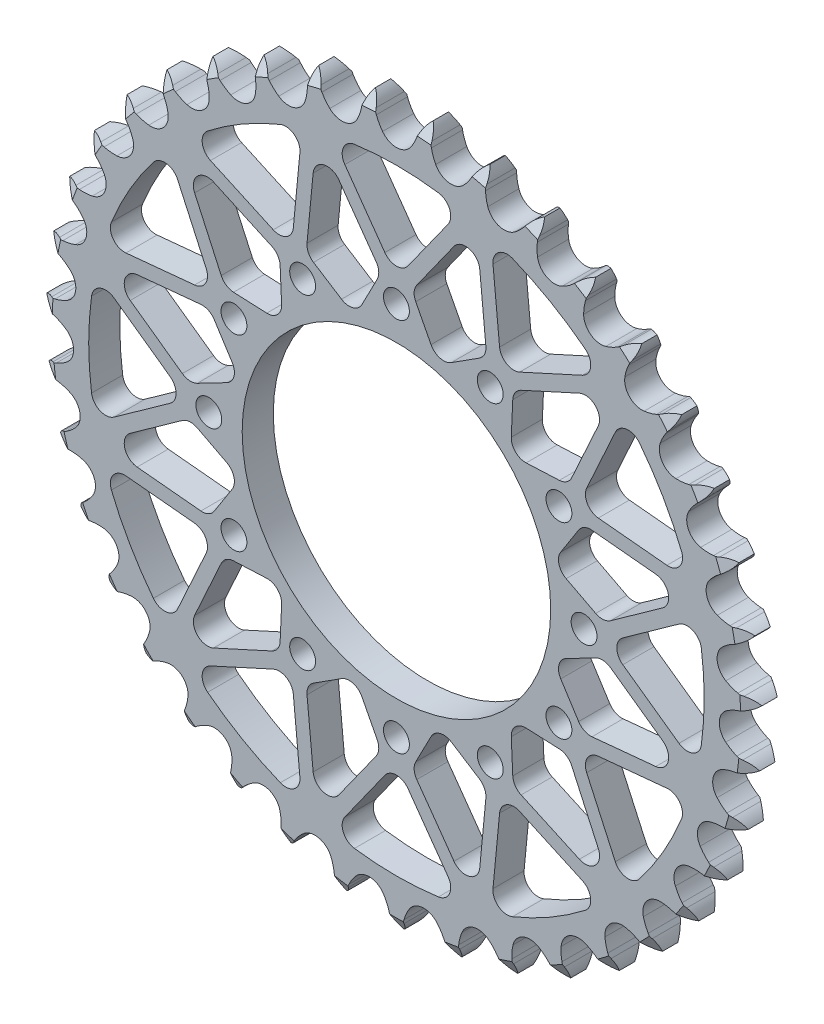
from build123d import *

# Parameters (mm, degrees)
EXTRUSION_DEPTH          = 7.2136
CUT_EXTRUDE_DEPTH        = 118.514389318
CUT_EXTRUDE_DEPTH_BACK   = 118.514389318
SKETCH1_R                = 35.764294032
F_6_0MM_DOWEL_HOLE1_D    = 6
CIRPATTERN1_COUNT        = 12
CUT_EXTRUDE2_DEPTH       = 118.514389318
FILLET2_R                = 3.302
CIRPATTERN3_COUNT        = 12
FILLET2_OF_CIRPATTERN3_R = 3.302


with BuildPart() as part:
    # Teeth Sketch → Extrusion (new body)
    with BuildSketch(Plane.XY):
        with BuildLine():
            ThreePointArc((6.676484762, 82.703103732), (5.710873677, 81.555589606), (5.037571935, 80.215493266))
            Line((5.037571935, 80.215493266), (4.65053543, 79.150636707))
            ThreePointArc((4.65053543, 79.150636707), (4.030589042, 77.787636082), (3.22092759, 76.5280518))
            ThreePointArc((3.22092759, 76.5280518), (0, 74.905926143), (-3.22092759, 76.5280518))
            ThreePointArc((-3.22092759, 76.5280518), (-4.030589042, 77.787636082), (-4.65053543, 79.150636707))
            Line((-4.65053543, 79.150636707), (-5.037571935, 80.215493266))
            ThreePointArc((-5.037571935, 80.215493266), (-5.710873677, 81.555589606), (-6.676484762, 82.703103732))
            ThreePointArc((-6.676484762, 82.703103732), (-7.445517227, 81.415554702), (-7.895133318, 79.984807062))
            Line((-7.895133318, 79.984807062), (-8.106342797, 78.871655094))
            ThreePointArc((-8.106342797, 78.871655094), (-8.499620367, 77.426858575), (-9.096745387, 76.053706749))
            ThreePointArc((-9.096745387, 76.053706749), (-12.015755556, 73.935914073), (-15.455180235, 75.020360508))
            ThreePointArc((-15.455180235, 75.020360508), (-16.456408311, 76.133754674), (-17.286967233, 77.379658404))
            Line((-17.286967233, 77.379658404), (-17.83980672, 78.368640329))
            ThreePointArc((-17.83980672, 78.368640329), (-18.719355953, 79.583377579), (-19.856536839, 80.561136787))
            ThreePointArc((-19.856536839, 80.561136787), (-20.409073146, 79.166899696), (-20.623358765, 77.682556369))
            Line((-20.623358765, 77.682556369), (-20.653271004, 76.549939044))
            ThreePointArc((-20.653271004, 76.549939044), (-20.809694072, 75.060766102), (-21.178817437, 73.609610642))
            ThreePointArc((-21.178817437, 73.609610642), (-23.720309356, 71.051000665), (-27.289151829, 71.569681286))
            ThreePointArc((-27.289151829, 71.569681286), (-28.456015249, 72.508049011), (-29.475675664, 73.604587595))
            Line((-29.475675664, 73.604587595), (-30.179999883, 74.492080773))
            ThreePointArc((-30.179999883, 74.492080773), (-31.243016742, 75.549997876), (-32.522315041, 76.332678717))
            ThreePointArc((-32.522315041, 76.332678717), (-32.844044791, 74.867863573), (-32.817450053, 73.368368272))
            Line((-32.817450053, 73.368368272), (-32.66529034, 72.245619783))
            ThreePointArc((-32.66529034, 72.245619783), (-32.580807632, 70.750639215), (-32.71236924, 69.259064285))
            ThreePointArc((-32.71236924, 69.259064285), (-34.810519602, 66.325903661), (-38.416348726, 66.265384911))
            ThreePointArc((-38.416348726, 66.265384911), (-39.71862634, 67.004422965), (-40.900979579, 67.923196629))
            Line((-40.900979579, 67.923196629), (-41.738546902, 68.686215454))
            ThreePointArc((-41.738546902, 68.686215454), (-42.957499809, 69.559912912), (-44.345782367, 70.127244363))
            ThreePointArc((-44.345782367, 70.127244363), (-44.428372928, 68.629789109), (-44.161586623, 67.153977974))
            Line((-44.161586623, 67.153977974), (-43.831295815, 66.070176918))
            ThreePointArc((-43.831295815, 66.070176918), (-43.508095388, 64.608107935), (-43.398687863, 63.114744543))
            ThreePointArc((-43.398687863, 63.114744543), (-44.999155676, 59.883000591), (-48.54858237, 59.244849876))
            ThreePointArc((-48.54858237, 59.244849876), (-49.952545871, 59.765417561), (-51.266969607, 60.48263055))
            Line((-51.266969607, 60.48263055), (-52.21608748, 61.101413234))
            ThreePointArc((-52.21608748, 61.101413234), (-53.559406195, 61.768262742), (-55.020717224, 62.105551216))
            ThreePointArc((-55.020717224, 62.105551216), (-54.862029543, 60.614239157), (-54.361961296, 59.200334922))
            Line((-54.361961296, 59.200334922), (-53.862093752, 58.183551176))
            ThreePointArc((-53.862093752, 58.183551176), (-53.308546327, 56.792260597), (-52.961003266, 55.335786069))
            ThreePointArc((-52.961003266, 55.335786069), (-54.022337255, 51.889159262), (-57.423433231, 50.689904348))
            ThreePointArc((-57.423433231, 50.689904348), (-58.892720703, 50.978519235), (-60.305172051, 51.475596109))
            Line((-60.305172051, 51.475596109), (-61.34125882, 51.934116506))
            ThreePointArc((-61.34125882, 51.934116506), (-62.774152094, 52.376847013), (-64.270644405, 52.475356916))
            ThreePointArc((-64.270644405, 52.475356916), (-63.87478841, 51.02881225), (-63.154389727, 49.713434291))
            Line((-63.154389727, 49.713434291), (-62.497891753, 48.790002021))
            ThreePointArc((-62.497891753, 48.790002021), (-61.728333918, 47.505523541), (-61.151656504, 46.123659804))
            ThreePointArc((-61.151656504, 46.123659804), (-61.646368676, 42.551415963), (-64.811047336, 40.822116924))
            ThreePointArc((-64.811047336, 40.822116924), (-66.307605004, 40.871304038), (-67.781502216, 41.135370767))
            Line((-67.781502216, 41.135370767), (-68.877723777, 41.42175344))
            ThreePointArc((-68.877723777, 41.42175344), (-70.363080428, 41.628898458), (-71.855995657, 41.486078435))
            ThreePointArc((-71.855995657, 41.486078435), (-71.23322381, 40.12176591), (-70.311152637, 38.938981826))
            Line((-70.311152637, 38.938981826), (-69.515027187, 38.132817442))
            ThreePointArc((-69.515027187, 38.132817442), (-68.549390085, 36.988418379), (-67.75851396, 35.716954977))
            ThreePointArc((-67.75851396, 35.716954977), (-67.673791529, 32.111613343), (-70.520089358, 29.897058114))
            ThreePointArc((-70.520089358, 29.897058114), (-72.005157166, 29.705543536), (-73.502327078, 29.729760931))
            Line((-73.502327078, 29.729760931), (-74.630291869, 29.836588719))
            ThreePointArc((-74.630291869, 29.836588719), (-76.129641939, 29.8027833), (-77.580314364, 29.422332315))
            ThreePointArc((-77.580314364, 29.422332315), (-76.74675613, 28.175586908), (-75.646893627, 27.156030185))
            Line((-75.646893627, 27.156030185), (-74.731759931, 26.488012922))
            ThreePointArc((-74.731759931, 26.488012922), (-73.595053056, 25.51333261), (-72.610461496, 24.385199777))
            ThreePointArc((-72.610461496, 24.385199777), (-71.948498729, 20.840136804), (-74.402698108, 18.197681204))
            ThreePointArc((-74.402698108, 18.197681204), (-75.837813579, 17.77042506), (-77.319480277, 17.554165902))
            Line((-77.319480277, 17.554165902), (-78.449974603, 17.478672021))
            ThreePointArc((-78.449974603, 17.478672021), (-79.924485713, 17.204791709), (-81.295343681, 16.596563242))
            ThreePointArc((-81.295343681, 16.596563242), (-80.27258778, 15.499675005), (-79.023419807, 14.669751627))
            Line((-79.023419807, 14.669751627), (-78.012979347, 14.15718278))
            ThreePointArc((-78.012979347, 14.15718278), (-76.734642811, 13.377464928), (-75.58183622, 12.421880712))
            ThreePointArc((-75.58183622, 12.421880712), (-74.359777605, 9.028911669), (-76.358316059, 6.026993909))
            ThreePointArc((-76.358316059, 6.026993909), (-77.706310456, 5.375061909), (-79.134099551, 4.923927198))
            Line((-79.134099551, 4.923927198), (-80.237844202, 4.6680669))
            ThreePointArc((-80.237844202, 4.6680669), (-81.649327289, 4.161205049), (-82.904866299, 3.340951899))
            ThreePointArc((-82.904866299, 3.340951899), (-81.719401571, 2.422329661), (-80.353280924, 1.803534207))
            Line((-80.353280924, 1.803534207), (-79.273703577, 1.45968904))
            ThreePointArc((-79.273703577, 1.45968904), (-77.886845624, 0.895127931), (-76.595681088, 0.136841462))
            ThreePointArc((-76.595681088, 0.136841462), (-74.8451773, -3.016157536), (-76.336293733, -6.299789363))
            ThreePointArc((-76.336293733, -6.299789363), (-77.56225471, -7.159512522), (-78.899187214, -7.833838635))
            Line((-78.899187214, -7.833838635), (-79.947595784, -8.263438702))
            ThreePointArc((-79.947595784, -8.263438702), (-81.259494176, -8.990154635), (-82.367196428, -10.001188343))
            ThreePointArc((-82.367196428, -10.001188343), (-81.049725787, -10.717752749), (-79.602034272, -11.109393802))
            Line((-79.602034272, -11.109393802), (-78.481280524, -11.275609878))
            ThreePointArc((-78.481280524, -11.275609878), (-77.021820047, -11.610392409), (-75.625738049, -12.151741911))
            ThreePointArc((-75.625738049, -12.151741911), (-73.392126218, -14.983109845), (-74.337201497, -18.463411399))
            ThreePointArc((-74.337201497, -18.463411399), (-75.409377308, -19.50865934), (-76.620827372, -20.388712162))
            Line((-76.620827372, -20.388712162), (-77.586746629, -20.980925582))
            ThreePointArc((-77.586746629, -20.980925582), (-78.765082849, -21.908674036), (-79.696259435, -23.08430306))
            ThreePointArc((-79.696259435, -23.08430306), (-78.280904679, -23.580250992), (-76.789136745, -23.734594346))
            Line((-76.789136745, -23.734594346), (-75.656233531, -23.718876424))
            ThreePointArc((-75.656233531, -23.718876424), (-74.161969788, -23.815209685), (-72.697128119, -24.125601551))
            ThreePointArc((-72.697128119, -24.125601551), (-70.038257617, -26.562007479), (-70.41281479, -30.148840778))
            ThreePointArc((-70.41281479, -30.148840778), (-71.303436645, -31.352542128), (-72.358028349, -32.415528753))
            Line((-72.358028349, -32.415528753), (-73.216441492, -33.155017511))
            ThreePointArc((-73.216441492, -33.155017511), (-74.230697248, -34.259770288), (-74.961231185, -35.569546454))
            ThreePointArc((-74.961231185, -35.569546454), (-73.484649258, -35.832033121), (-71.987440912, -35.745081364))
            Line((-71.987440912, -35.745081364), (-70.871729829, -35.547836529))
            ThreePointArc((-70.871729829, -35.547836529), (-69.381363468, -35.403225539), (-67.885700756, -35.474620783))
            ThreePointArc((-67.885700756, -35.474620783), (-64.870434934, -37.452963072), (-64.664773166, -41.053431017))
            ThreePointArc((-64.664773166, -41.053431017), (-65.350774426, -42.384410543), (-66.221194398, -43.602800177))
            Line((-66.221194398, -43.602800177), (-66.949868978, -44.470411902))
            ThreePointArc((-66.949868978, -44.470411902), (-67.773775581, -45.723556485), (-68.284746423, -47.133557278))
            ThreePointArc((-68.284746423, -47.133557278), (-66.785180021, -47.155784414), (-65.321308173, -46.829789551))
            Line((-65.321308173, -46.829789551), (-64.251685552, -46.456126341))
            ThreePointArc((-64.251685552, -46.456126341), (-62.803816278, -46.074316448), (-61.316069403, -45.904865971))
            ThreePointArc((-61.316069403, -45.904865971), (-58.022502061, -47.373906594), (-57.241947884, -50.894758957))
            ThreePointArc((-57.241947884, -50.894758957), (-57.705561477, -52.318544989), (-58.369266298, -53.66078198))
            Line((-58.369266298, -53.66078198), (-58.949330025, -54.634045983))
            ThreePointArc((-58.949330025, -54.634045983), (-59.561548726, -56.003126587), (-59.839722596, -57.476833727))
            ThreePointArc((-59.839722596, -57.476833727), (-58.356009703, -57.25822566), (-56.963387864, -56.701630787))
            Line((-56.963387864, -56.701630787), (-55.967556369, -56.161226883))
            ThreePointArc((-55.967556369, -56.161226883), (-54.599683236, -55.552106762), (-53.15838406, -55.146199243))
            ThreePointArc((-53.15838406, -55.146199243), (-49.671816862, -56.06789082), (-48.336586219, -59.417939375))
            ThreePointArc((-48.336586219, -59.417939375), (-48.565804798, -60.897656602), (-49.00560486, -62.328977716))
            Line((-49.00560486, -62.328977716), (-49.422034389, -63.382686971))
            ThreePointArc((-49.422034389, -63.382686971), (-49.806709045, -64.832245127), (-49.844881387, -66.331490374))
            ThreePointArc((-49.844881387, -66.331490374), (-48.415449386, -65.877708938), (-47.130145731, -65.104929569))
            Line((-47.130145731, -65.104929569), (-46.233896874, -64.411781148))
            ThreePointArc((-46.233896874, -64.411781148), (-44.981447078, -63.591126692), (-43.623924493, -62.959274922))
            ThreePointArc((-43.623924493, -62.959274922), (-40.034657698, -63.309746125), (-38.179332362, -66.402226373))
            ThreePointArc((-38.179332362, -66.402226373), (-38.168219284, -67.899550896), (-38.372723998, -69.38288567))
            Line((-38.372723998, -69.38288567), (-38.614734022, -70.489749661))
            ThreePointArc((-38.614734022, -70.489749661), (-38.761901763, -71.982242573), (-38.559083932, -73.468196262))
            ThreePointArc((-38.559083932, -73.468196262), (-37.220954361, -72.790994159), (-36.076257579, -71.822044874))
            Line((-36.076257579, -71.822044874), (-35.302803736, -70.994104116))
            ThreePointArc((-35.302803736, -70.994104116), (-34.198215068, -69.983169844), (-32.959628196, -69.141738451))
            ThreePointArc((-32.959628196, -69.141738451), (-29.360621929, -68.91191226), (-27.033253851, -71.666730588))
            ThreePointArc((-27.033253851, -71.666730588), (-26.78209694, -73.142882488), (-26.74600974, -74.639813329))
            Line((-26.74600974, -74.639813329), (-26.807332328, -75.77116486))
            ThreePointArc((-26.807332328, -75.77116486), (-26.713181585, -77.267937748), (-26.274626458, -78.702114459))
            ThreePointArc((-26.274626458, -78.702114459), (-25.06245617, -77.819030866), (-24.088013307, -76.679006943))
            Line((-24.088013307, -76.679006943), (-23.457386525, -75.737717079))
            ThreePointArc((-23.457386525, -75.737717079), (-22.529267252, -74.562685657), (-21.441694841, -73.533467273))
            ThreePointArc((-21.441694841, -73.533467273), (-17.926161474, -72.729296065), (-15.187028265, -75.075104125))
            ThreePointArc((-15.187028265, -75.075104125), (-14.702332353, -76.491851845), (-14.426587879, -77.96360903))
            Line((-14.426587879, -77.96360903), (-14.305634807, -79.090146691))
            ThreePointArc((-14.305634807, -79.090146691), (-13.972604036, -80.552433921), (-13.309669959, -81.897689231))
            ThreePointArc((-13.309669959, -81.897689231), (-12.254853529, -80.83159555), (-11.475902142, -79.55002301))
            Line((-11.475902142, -79.55002301), (-11.004435324, -78.519762952))
            ThreePointArc((-11.004435324, -78.519762952), (-10.276823247, -77.211067077), (-9.368432854, -76.020717918))
            ThreePointArc((-9.368432854, -76.020717918), (-6.027422853, -74.663029306), (-2.947466624, -76.5390719))
            ThreePointArc((-2.947466624, -76.5390719), (-2.241785081, -77.859722417), (-1.733524971, -79.26818821))
            Line((-1.733524971, -79.26818821), (-1.43342886, -80.360735266))
            ThreePointArc((-1.43342886, -80.360735266), (-0.870143382, -81.750664368), (0, -82.97215687))
            ThreePointArc((0, -82.97215687), (0.870143382, -81.750664368), (1.43342886, -80.360735266))
            Line((1.43342886, -80.360735266), (1.733524971, -79.26818821))
            ThreePointArc((1.733524971, -79.26818821), (2.241785081, -77.859722417), (2.947466624, -76.5390719))
            ThreePointArc((2.947466624, -76.5390719), (6.027422853, -74.663029306), (9.368432854, -76.020717918))
            ThreePointArc((9.368432854, -76.020717918), (10.276823247, -77.211067077), (11.004435324, -78.519762952))
            Line((11.004435324, -78.519762952), (11.475902142, -79.55002301))
            ThreePointArc((11.475902142, -79.55002301), (12.254853529, -80.83159555), (13.309669959, -81.897689231))
            ThreePointArc((13.309669959, -81.897689231), (13.972604036, -80.552433921), (14.305634807, -79.090146691))
            Line((14.305634807, -79.090146691), (14.426587879, -77.96360903))
            ThreePointArc((14.426587879, -77.96360903), (14.702332353, -76.491851845), (15.187028265, -75.075104125))
            ThreePointArc((15.187028265, -75.075104125), (17.926161474, -72.729296065), (21.441694841, -73.533467273))
            ThreePointArc((21.441694841, -73.533467273), (22.529267252, -74.562685657), (23.457386525, -75.737717079))
            Line((23.457386525, -75.737717079), (24.088013307, -76.679006943))
            ThreePointArc((24.088013307, -76.679006943), (25.06245617, -77.819030866), (26.274626458, -78.702114459))
            ThreePointArc((26.274626458, -78.702114459), (26.713181585, -77.267937748), (26.807332328, -75.77116486))
            Line((26.807332328, -75.77116486), (26.74600974, -74.639813329))
            ThreePointArc((26.74600974, -74.639813329), (26.78209694, -73.142882488), (27.033253851, -71.666730588))
            ThreePointArc((27.033253851, -71.666730588), (29.360621929, -68.91191226), (32.959628196, -69.141738451))
            ThreePointArc((32.959628196, -69.141738451), (34.198215068, -69.983169844), (35.302803736, -70.994104116))
            Line((35.302803736, -70.994104116), (36.076257579, -71.822044874))
            ThreePointArc((36.076257579, -71.822044874), (37.220954361, -72.790994159), (38.559083932, -73.468196262))
            ThreePointArc((38.559083932, -73.468196262), (38.761901763, -71.982242573), (38.614734022, -70.489749661))
            Line((38.614734022, -70.489749661), (38.372723998, -69.38288567))
            ThreePointArc((38.372723998, -69.38288567), (38.168219284, -67.899550896), (38.179332362, -66.402226373))
            ThreePointArc((38.179332362, -66.402226373), (40.034657698, -63.309746125), (43.623924493, -62.959274922))
            ThreePointArc((43.623924493, -62.959274922), (44.981447078, -63.591126692), (46.233896874, -64.411781148))
            Line((46.233896874, -64.411781148), (47.130145731, -65.104929569))
            ThreePointArc((47.130145731, -65.104929569), (48.415449386, -65.877708938), (49.844881387, -66.331490374))
            ThreePointArc((49.844881387, -66.331490374), (49.806709045, -64.832245127), (49.422034389, -63.382686971))
            Line((49.422034389, -63.382686971), (49.00560486, -62.328977716))
            ThreePointArc((49.00560486, -62.328977716), (48.565804798, -60.897656602), (48.336586219, -59.417939375))
            ThreePointArc((48.336586219, -59.417939375), (49.671816862, -56.06789082), (53.15838406, -55.146199243))
            ThreePointArc((53.15838406, -55.146199243), (54.599683236, -55.552106762), (55.967556369, -56.161226883))
            Line((55.967556369, -56.161226883), (56.963387864, -56.701630787))
            ThreePointArc((56.963387864, -56.701630787), (58.356009703, -57.25822566), (59.839722596, -57.476833727))
            ThreePointArc((59.839722596, -57.476833727), (59.561548726, -56.003126587), (58.949330025, -54.634045983))
            Line((58.949330025, -54.634045983), (58.369266298, -53.66078198))
            ThreePointArc((58.369266298, -53.66078198), (57.705561477, -52.318544989), (57.241947884, -50.894758957))
            ThreePointArc((57.241947884, -50.894758957), (58.022502061, -47.373906594), (61.316069403, -45.904865971))
            ThreePointArc((61.316069403, -45.904865971), (62.803816278, -46.074316448), (64.251685552, -46.456126341))
            Line((64.251685552, -46.456126341), (65.321308173, -46.829789551))
            ThreePointArc((65.321308173, -46.829789551), (66.785180021, -47.155784414), (68.284746423, -47.133557278))
            ThreePointArc((68.284746423, -47.133557278), (67.773775581, -45.723556485), (66.949868978, -44.470411902))
            Line((66.949868978, -44.470411902), (66.221194398, -43.602800177))
            ThreePointArc((66.221194398, -43.602800177), (65.350774426, -42.384410543), (64.664773166, -41.053431017))
            ThreePointArc((64.664773166, -41.053431017), (64.870434934, -37.452963072), (67.885700756, -35.474620783))
            ThreePointArc((67.885700756, -35.474620783), (69.381363468, -35.403225539), (70.871729829, -35.547836529))
            Line((70.871729829, -35.547836529), (71.987440912, -35.745081364))
            ThreePointArc((71.987440912, -35.745081364), (73.484649258, -35.832033121), (74.961231185, -35.569546454))
            ThreePointArc((74.961231185, -35.569546454), (74.230697248, -34.259770288), (73.216441492, -33.155017511))
            Line((73.216441492, -33.155017511), (72.358028349, -32.415528753))
            ThreePointArc((72.358028349, -32.415528753), (71.303436645, -31.352542128), (70.41281479, -30.148840778))
            ThreePointArc((70.41281479, -30.148840778), (70.038257617, -26.562007479), (72.697128119, -24.125601551))
            ThreePointArc((72.697128119, -24.125601551), (74.161969788, -23.815209685), (75.656233531, -23.718876424))
            Line((75.656233531, -23.718876424), (76.789136745, -23.734594346))
            ThreePointArc((76.789136745, -23.734594346), (78.280904679, -23.580250992), (79.696259435, -23.08430306))
            ThreePointArc((79.696259435, -23.08430306), (78.765082849, -21.908674036), (77.586746629, -20.980925582))
            Line((77.586746629, -20.980925582), (76.620827372, -20.388712162))
            ThreePointArc((76.620827372, -20.388712162), (75.409377308, -19.50865934), (74.337201497, -18.463411399))
            ThreePointArc((74.337201497, -18.463411399), (73.392126218, -14.983109845), (75.625738049, -12.151741911))
            ThreePointArc((75.625738049, -12.151741911), (77.021820047, -11.610392409), (78.481280524, -11.275609878))
            Line((78.481280524, -11.275609878), (79.602034272, -11.109393802))
            ThreePointArc((79.602034272, -11.109393802), (81.049725787, -10.717752749), (82.367196428, -10.001188343))
            ThreePointArc((82.367196428, -10.001188343), (81.259494176, -8.990154635), (79.947595784, -8.263438702))
            Line((79.947595784, -8.263438702), (78.899187214, -7.833838635))
            ThreePointArc((78.899187214, -7.833838635), (77.56225471, -7.159512522), (76.336293733, -6.299789363))
            ThreePointArc((76.336293733, -6.299789363), (74.8451773, -3.016157536), (76.595681088, 0.136841462))
            ThreePointArc((76.595681088, 0.136841462), (77.886845624, 0.895127931), (79.273703577, 1.45968904))
            Line((79.273703577, 1.45968904), (80.353280924, 1.803534207))
            ThreePointArc((80.353280924, 1.803534207), (81.719401571, 2.422329661), (82.904866299, 3.340951899))
            ThreePointArc((82.904866299, 3.340951899), (81.649327289, 4.161205049), (80.237844202, 4.6680669))
            Line((80.237844202, 4.6680669), (79.134099551, 4.923927198))
            ThreePointArc((79.134099551, 4.923927198), (77.706310456, 5.375061909), (76.358316059, 6.026993909))
            ThreePointArc((76.358316059, 6.026993909), (74.359777605, 9.028911669), (75.58183622, 12.421880712))
            ThreePointArc((75.58183622, 12.421880712), (76.734642811, 13.377464928), (78.012979347, 14.15718278))
            Line((78.012979347, 14.15718278), (79.023419807, 14.669751627))
            ThreePointArc((79.023419807, 14.669751627), (80.27258778, 15.499675005), (81.295343681, 16.596563242))
            ThreePointArc((81.295343681, 16.596563242), (79.924485713, 17.204791709), (78.449974603, 17.478672021))
            Line((78.449974603, 17.478672021), (77.319480277, 17.554165902))
            ThreePointArc((77.319480277, 17.554165902), (75.837813579, 17.77042506), (74.402698108, 18.197681204))
            ThreePointArc((74.402698108, 18.197681204), (71.948498729, 20.840136804), (72.610461496, 24.385199777))
            ThreePointArc((72.610461496, 24.385199777), (73.595053056, 25.51333261), (74.731759931, 26.488012922))
            Line((74.731759931, 26.488012922), (75.646893627, 27.156030185))
            ThreePointArc((75.646893627, 27.156030185), (76.74675613, 28.175586908), (77.580314364, 29.422332315))
            ThreePointArc((77.580314364, 29.422332315), (76.129641939, 29.8027833), (74.630291869, 29.836588719))
            Line((74.630291869, 29.836588719), (73.502327078, 29.729760931))
            ThreePointArc((73.502327078, 29.729760931), (72.005157166, 29.705543536), (70.520089358, 29.897058114))
            ThreePointArc((70.520089358, 29.897058114), (67.673791529, 32.111613343), (67.75851396, 35.716954977))
            ThreePointArc((67.75851396, 35.716954977), (68.549390085, 36.988418379), (69.515027187, 38.132817442))
            Line((69.515027187, 38.132817442), (70.311152637, 38.938981826))
            ThreePointArc((70.311152637, 38.938981826), (71.23322381, 40.12176591), (71.855995657, 41.486078435))
            ThreePointArc((71.855995657, 41.486078435), (70.363080428, 41.628898458), (68.877723777, 41.42175344))
            Line((68.877723777, 41.42175344), (67.781502216, 41.135370767))
            ThreePointArc((67.781502216, 41.135370767), (66.307605004, 40.871304038), (64.811047336, 40.822116924))
            ThreePointArc((64.811047336, 40.822116924), (61.646368676, 42.551415963), (61.151656504, 46.123659804))
            ThreePointArc((61.151656504, 46.123659804), (61.728333918, 47.505523541), (62.497891753, 48.790002021))
            Line((62.497891753, 48.790002021), (63.154389727, 49.713434291))
            ThreePointArc((63.154389727, 49.713434291), (63.87478841, 51.02881225), (64.270644405, 52.475356916))
            ThreePointArc((64.270644405, 52.475356916), (62.774152094, 52.376847013), (61.34125882, 51.934116506))
            Line((61.34125882, 51.934116506), (60.305172051, 51.475596109))
            ThreePointArc((60.305172051, 51.475596109), (58.892720703, 50.978519235), (57.423433231, 50.689904348))
            ThreePointArc((57.423433231, 50.689904348), (54.022337255, 51.889159262), (52.961003266, 55.335786069))
            ThreePointArc((52.961003266, 55.335786069), (53.308546327, 56.792260597), (53.862093752, 58.183551176))
            Line((53.862093752, 58.183551176), (54.361961296, 59.200334922))
            ThreePointArc((54.361961296, 59.200334922), (54.862029543, 60.614239157), (55.020717224, 62.105551216))
            ThreePointArc((55.020717224, 62.105551216), (53.559406195, 61.768262742), (52.21608748, 61.101413234))
            Line((52.21608748, 61.101413234), (51.266969607, 60.48263055))
            ThreePointArc((51.266969607, 60.48263055), (49.952545871, 59.765417561), (48.54858237, 59.244849876))
            ThreePointArc((48.54858237, 59.244849876), (44.999155676, 59.883000591), (43.398687863, 63.114744543))
            ThreePointArc((43.398687863, 63.114744543), (43.508095388, 64.608107935), (43.831295815, 66.070176918))
            Line((43.831295815, 66.070176918), (44.161586623, 67.153977974))
            ThreePointArc((44.161586623, 67.153977974), (44.428372928, 68.629789109), (44.345782367, 70.127244363))
            ThreePointArc((44.345782367, 70.127244363), (42.957499809, 69.559912912), (41.738546902, 68.686215454))
            Line((41.738546902, 68.686215454), (40.900979579, 67.923196629))
            ThreePointArc((40.900979579, 67.923196629), (39.71862634, 67.004422965), (38.416348726, 66.265384911))
            ThreePointArc((38.416348726, 66.265384911), (34.810519602, 66.325903661), (32.71236924, 69.259064285))
            ThreePointArc((32.71236924, 69.259064285), (32.580807632, 70.750639215), (32.66529034, 72.245619783))
            Line((32.66529034, 72.245619783), (32.817450053, 73.368368272))
            ThreePointArc((32.817450053, 73.368368272), (32.844044791, 74.867863573), (32.522315041, 76.332678717))
            ThreePointArc((32.522315041, 76.332678717), (31.243016742, 75.549997876), (30.179999883, 74.492080773))
            Line((30.179999883, 74.492080773), (29.475675664, 73.604587595))
            ThreePointArc((29.475675664, 73.604587595), (28.456015249, 72.508049011), (27.289151829, 71.569681286))
            ThreePointArc((27.289151829, 71.569681286), (23.720309356, 71.051000665), (21.178817437, 73.609610642))
            ThreePointArc((21.178817437, 73.609610642), (20.809694072, 75.060766102), (20.653271004, 76.549939044))
            Line((20.653271004, 76.549939044), (20.623358765, 77.682556369))
            ThreePointArc((20.623358765, 77.682556369), (20.409073146, 79.166899696), (19.856536839, 80.561136787))
            ThreePointArc((19.856536839, 80.561136787), (18.719355953, 79.583377579), (17.83980672, 78.368640329))
            Line((17.83980672, 78.368640329), (17.286967233, 77.379658404))
            ThreePointArc((17.286967233, 77.379658404), (16.456408311, 76.133754674), (15.455180235, 75.020360508))
            ThreePointArc((15.455180235, 75.020360508), (12.015755556, 73.935914073), (9.096745387, 76.053706749))
            ThreePointArc((9.096745387, 76.053706749), (8.499620367, 77.426858575), (8.106342797, 78.871655094))
            Line((8.106342797, 78.871655094), (7.895133318, 79.984807062))
            ThreePointArc((7.895133318, 79.984807062), (7.445517227, 81.415554702), (6.676484762, 82.703103732))
        make_face()
    extrude(amount=EXTRUSION_DEPTH)

    # Sketch1 → Cut-Extrude (cut, two sides: drawn at the far end of the back side and taken through both)
    with BuildSketch(Plane(origin=(0, 0, 0), x_dir=(-1, 0, 0), z_dir=(0, 0, -1)).offset(-CUT_EXTRUDE_DEPTH_BACK)):
        Circle(SKETCH1_R)
    extrude(amount=CUT_EXTRUDE_DEPTH + CUT_EXTRUDE_DEPTH_BACK, mode=Mode.SUBTRACT)

    # Ø6.0mm Dowel Hole1 (through all)
    with Locations(Plane.XY.offset(7.2136)):
        with Locations((-43.500000122, 0)):
            f_6_0mm_dowel_hole1 = Hole(F_6_0MM_DOWEL_HOLE1_D / 2)

    # CirPattern1: Ø6.0mm Dowel Hole1 ×12 about axis
    cirpattern1_axis = Axis((0, 0, 7.2136), (0, 0, -1))
    for i in range(1, CIRPATTERN1_COUNT):
        add(f_6_0mm_dowel_hole1.rotate(cirpattern1_axis, i * 360 / CIRPATTERN1_COUNT), mode=Mode.SUBTRACT)

    # Sketch9 → Cut-Extrude2 (cut, through all)
    with BuildSketch(Plane.XY):
        with BuildLine():
            Line((-48.707000122, 0), (-69.753908506, 15.006805414))
            ThreePointArc((-69.753908506, 15.006805414), (-71.349926143, 0), (-69.753908506, -15.006805414))
            Line((-69.753908506, -15.006805414), (-48.707000122, 0))
        make_face()
        Polygon((-43.325238517, 20.926367996), (-68.918736366, 18.466719753), (-47.983941179, 3.539852965), (-36.140398804, 9.683790674), align=None)
    cut_extrude2 = extrude(amount=CUT_EXTRUDE2_DEPTH, mode=Mode.SUBTRACT)

    # Fillet2
    fillet2_edges = [part.edges().sort_by_distance(p)[0] for p in [
        (-68.918736366, 18.466719753, 3.6068),
        (-36.140398804, 9.683790674, 3.6068),
        (-47.983941179, 3.539852965, 3.6068),
        (-43.325238517, 20.926367996, 3.6068),
        (-69.753908506, -15.006805414, 3.6068),
        (-48.707000122, 0, 3.6068),
        (-69.753908506, 15.006805414, 3.6068),
    ]]
    fillet(fillet2_edges, radius=FILLET2_R)

    # CirPattern3: Cut-Extrude2 ×12 about axis
    cirpattern3_axis = Axis((0, 0, 7.2136), (0, 0, -1))
    for i in range(1, CIRPATTERN3_COUNT):
        add(cut_extrude2.rotate(cirpattern3_axis, i * 360 / CIRPATTERN3_COUNT), mode=Mode.SUBTRACT)

    # Fillet2 of CirPattern3
    fillet2_of_cirpattern3_edges = [part.edges().sort_by_distance(p)[0] for p in [
        (-50.452016613, 50.452016613, 3.6068),
        (-26.45660813, 26.45660813, 3.6068),
        (-39.785385552, 27.057573183, 3.6068),
        (-27.057573183, 39.785385552, 3.6068),
        (-67.912059487, 21.880679535, 3.6068),
        (-42.181499448, 24.353500061, 3.6068),
        (-52.905254073, 47.873228971, 3.6068),
        (-18.466719753, 68.918736366, 3.6068),
        (-9.683790674, 36.140398804, 3.6068),
        (-20.926367996, 43.325238517, 3.6068),
        (-3.539852965, 47.983941179, 3.6068),
        (-47.873228971, 52.905254073, 3.6068),
        (-24.353500061, 42.181499448, 3.6068),
        (-21.880679535, 67.912059487, 3.6068),
        (18.466719753, 68.918736366, 3.6068),
        (9.683790674, 36.140398804, 3.6068),
        (3.539852965, 47.983941179, 3.6068),
        (20.926367996, 43.325238517, 3.6068),
        (-15.006805414, 69.753908506, 3.6068),
        (0, 48.707000122, 3.6068),
        (15.006805414, 69.753908506, 3.6068),
        (50.452016613, 50.452016613, 3.6068),
        (26.45660813, 26.45660813, 3.6068),
        (27.057573183, 39.785385552, 3.6068),
        (39.785385552, 27.057573183, 3.6068),
        (21.880679535, 67.912059487, 3.6068),
        (24.353500061, 42.181499448, 3.6068),
        (47.873228971, 52.905254073, 3.6068),
        (68.918736366, 18.466719753, 3.6068),
        (36.140398804, 9.683790674, 3.6068),
        (43.325238517, 20.926367996, 3.6068),
        (47.983941179, 3.539852965, 3.6068),
        (52.905254073, 47.873228971, 3.6068),
        (42.181499448, 24.353500061, 3.6068),
        (67.912059487, 21.880679535, 3.6068),
        (68.918736366, -18.466719753, 3.6068),
        (36.140398804, -9.683790674, 3.6068),
        (47.983941179, -3.539852965, 3.6068),
        (43.325238517, -20.926367996, 3.6068),
        (69.753908506, 15.006805414, 3.6068),
        (48.707000122, 0, 3.6068),
        (69.753908506, -15.006805414, 3.6068),
        (50.452016613, -50.452016613, 3.6068),
        (26.45660813, -26.45660813, 3.6068),
        (39.785385552, -27.057573183, 3.6068),
        (27.057573183, -39.785385552, 3.6068),
        (67.912059487, -21.880679535, 3.6068),
        (42.181499448, -24.353500061, 3.6068),
        (52.905254073, -47.873228971, 3.6068),
        (18.466719753, -68.918736366, 3.6068),
        (9.683790674, -36.140398804, 3.6068),
        (20.926367996, -43.325238517, 3.6068),
        (3.539852965, -47.983941179, 3.6068),
        (47.873228971, -52.905254073, 3.6068),
        (24.353500061, -42.181499448, 3.6068),
        (21.880679535, -67.912059487, 3.6068),
        (-18.466719753, -68.918736366, 3.6068),
        (-9.683790674, -36.140398804, 3.6068),
        (-3.539852965, -47.983941179, 3.6068),
        (-20.926367996, -43.325238517, 3.6068),
        (15.006805414, -69.753908506, 3.6068),
        (0, -48.707000122, 3.6068),
        (-15.006805414, -69.753908506, 3.6068),
        (-50.452016613, -50.452016613, 3.6068),
        (-26.45660813, -26.45660813, 3.6068),
        (-27.057573183, -39.785385552, 3.6068),
        (-39.785385552, -27.057573183, 3.6068),
        (-21.880679535, -67.912059487, 3.6068),
        (-24.353500061, -42.181499448, 3.6068),
        (-47.873228971, -52.905254073, 3.6068),
        (-68.918736366, -18.466719753, 3.6068),
        (-36.140398804, -9.683790674, 3.6068),
        (-43.325238517, -20.926367996, 3.6068),
        (-47.983941179, -3.539852965, 3.6068),
        (-52.905254073, -47.873228971, 3.6068),
        (-42.181499448, -24.353500061, 3.6068),
        (-67.912059487, -21.880679535, 3.6068),
    ]]
    fillet(fillet2_of_cirpattern3_edges, radius=FILLET2_OF_CIRPATTERN3_R)

    # Sketch18 → Cut-Revolve2 (revolve, cut)
    with BuildSketch(Plane(origin=(0, 0, 0), x_dir=(0, 0, -1), z_dir=(1, 0, 0))):
        Polygon((-7.2136, -82.97215687), (-5.3848, -82.97215687), (-7.2136, -79.778574738), align=None)
    cut_revolve2 = revolve(axis=Axis((0, 0, -0.36068), (0, 0, 1)), mode=Mode.SUBTRACT)

    # Mirror1: Cut-Revolve2 across plane
    add(cut_revolve2.mirror(Plane(origin=(0, 0, 3.6068), x_dir=(1, 0, 0), z_dir=(0, 0, -1))), mode=Mode.SUBTRACT)


solid = part.part
